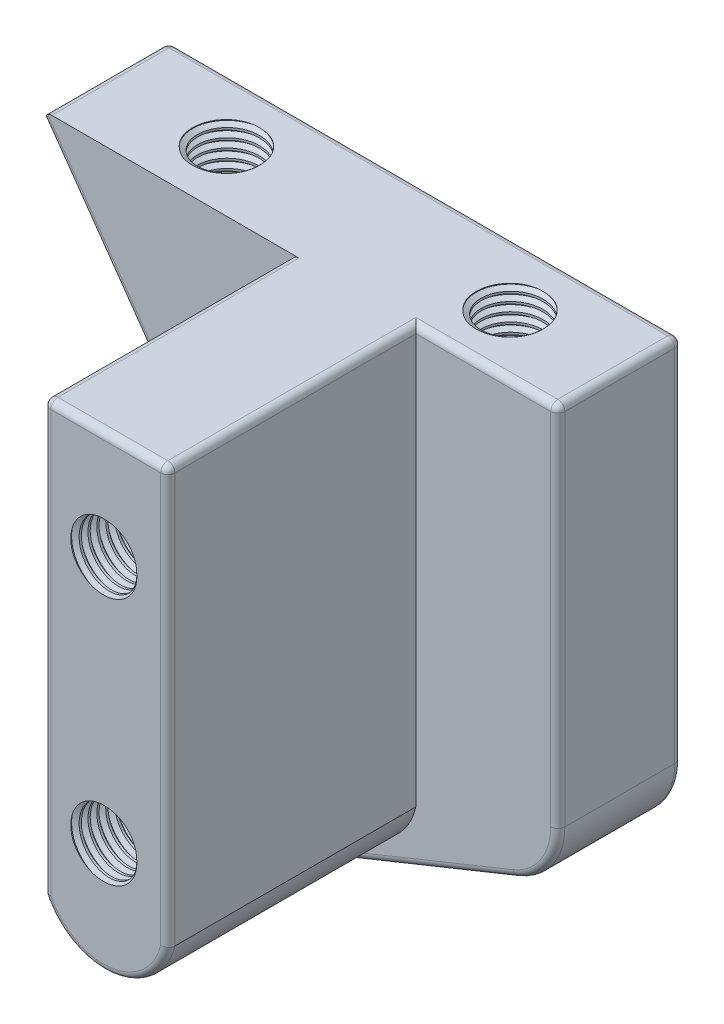
from build123d import *

# Parameters (mm, degrees)
BOSS_EXTRUDE1_DEPTH = 17.5
BOSS_EXTRUDE2_DEPTH = 70
FILLET1_R           = 2
SKETCH5_R           = 8.75
CUT_EXTRUDE1_DEPTH  = 20
THREAD2_PITCH       = 2.5
LPATTERN1_COUNT     = 2
LPATTERN1_PITCH     = 80
SKETCH14_R          = 8.75
CUT_EXTRUDE2_DEPTH  = 20
THREAD3_PITCH       = 2.5
LPATTERN4_COUNT     = 2
LPATTERN4_PITCH     = 70


with BuildPart() as part:
    # Sketch3 → Boss-Extrude1 (new, symmetric)
    with BuildSketch(Plane.XY):
        with BuildLine():
            Line((7.435410701, 82.5), (39.812976188, 36.481871211))
            ThreePointArc((39.812976188, 36.481871211), (51.493625225, 16.260583053), (53.54415303, -7.001690964))
            Line((53.54415303, -7.001690964), (45.131528365, -71.335701811))
            ThreePointArc((45.131528365, -71.335701811), (46.65027305, -75.018172101), (50.596188297, -75.563081004))
            Line((50.596188297, -75.563081004), (142.117525275, -38.586060642))
            ThreePointArc((142.117525275, -38.586060642), (150.751713879, -31.594232571), (154, -20.969567405))
            Line((154, -20.969567405), (154, 82.5))
            Line((154, 82.5), (7.435410701, 82.5))
        make_face()
    extrude(amount=BOSS_EXTRUDE1_DEPTH, both=True)

    # Sketch4 → Boss-Extrude2 (add)
    with BuildSketch(Plane.XY.offset(17.5)):
        with BuildLine():
            Line((79, 82.5), (79, -38.745011857))
            ThreePointArc((79, -38.745011857), (97.820651906, -49.432851687), (114, -35.056636828))
            Line((114, -35.056636828), (114, 82.5))
            Line((114, 82.5), (79, 82.5))
        make_face()
    extrude(amount=BOSS_EXTRUDE2_DEPTH)

    # Fillet1
    # the kernel refuses this fillet: 2 mm, written as the material it takes off along each edge
    with BuildSketch(Plane(origin=(11.28800378, 80.5, -15.5), x_dir=(0, 1, 0), z_dir=(0, 0, -1))) as fillet1_piece_1_section:
        Polygon((0, 0), (FILLET1_R, 0), (FILLET1_R, -FILLET1_R * 1.92629653958), (-FILLET1_R * 0.575427290467, -FILLET1_R * 0.817852941173), align=None)
    fillet1_piece_1 = extrude(amount=FILLET1_R, mode=Mode.PRIVATE)
    fillet1_piece_1 = fillet1_piece_1 - Plane(origin=(11.28800378, 80.5, -15.5), x_dir=(0.8875323347537564, -0.4607454337989103, 0), z_dir=(0, 0, -1)) * Sphere(FILLET1_R, mode=Mode.PRIVATE)
    add(fillet1_piece_1, mode=Mode.SUBTRACT)
    with BuildSketch(Plane(origin=(152, 80.5, -15.5), x_dir=(0, 0, -1), z_dir=(1, 0, 0))) as fillet1_piece_2_section:
        Polygon((0, 0), (FILLET1_R, 0), (FILLET1_R, FILLET1_R), (0, FILLET1_R), align=None)
    fillet1_piece_2 = extrude(amount=FILLET1_R, mode=Mode.PRIVATE)
    fillet1_piece_2 = fillet1_piece_2 - Plane(origin=(152, 80.5, -15.5), x_dir=(0, -0.7071067811865475, 0.7071067811865475), z_dir=(1, 0, 0)) * Sphere(FILLET1_R, mode=Mode.PRIVATE)
    add(fillet1_piece_2, mode=Mode.SUBTRACT)
    with BuildSketch(Plane(origin=(152, 80.5, 15.5), x_dir=(0, 1, 0), z_dir=(1, 0, 0))) as fillet1_piece_3_section:
        Polygon((0, 0), (FILLET1_R, 0), (FILLET1_R, FILLET1_R), (0, FILLET1_R), align=None)
    fillet1_piece_3 = extrude(amount=FILLET1_R, mode=Mode.PRIVATE)
    fillet1_piece_3 = fillet1_piece_3 - Plane(origin=(152, 80.5, 15.5), x_dir=(0, -0.7071067811865475, -0.7071067811865475), z_dir=(1, 0, 0)) * Sphere(FILLET1_R, mode=Mode.PRIVATE)
    add(fillet1_piece_3, mode=Mode.SUBTRACT)
    with BuildSketch(Plane(origin=(81, 80.5, 85.5), x_dir=(0, 1, 0), z_dir=(-1, 0, 0))) as fillet1_piece_4_section:
        Polygon((0, 0), (FILLET1_R, 0), (FILLET1_R, -FILLET1_R), (0, -FILLET1_R), align=None)
    fillet1_piece_4 = extrude(amount=FILLET1_R, mode=Mode.PRIVATE)
    fillet1_piece_4 = fillet1_piece_4 - Plane(origin=(81, 80.5, 85.5), x_dir=(0, -0.7071067811865475, -0.7071067811865475), z_dir=(-1, 0, 0)) * Sphere(FILLET1_R, mode=Mode.PRIVATE)
    add(fillet1_piece_4, mode=Mode.SUBTRACT)
    with BuildSketch(Plane(origin=(112, 80.5, 85.5), x_dir=(1, 0, 0), z_dir=(0, 1, 0))) as fillet1_piece_5_section:
        Polygon((0, 0), (FILLET1_R, 0), (FILLET1_R, -FILLET1_R), (0, -FILLET1_R), align=None)
    fillet1_piece_5 = extrude(amount=FILLET1_R, mode=Mode.PRIVATE)
    fillet1_piece_5 = fillet1_piece_5 - Plane(origin=(112, 80.5, 85.5), x_dir=(-0.7071067811865475, 0, -0.7071067811865475), z_dir=(0, 1, 0)) * Sphere(FILLET1_R, mode=Mode.PRIVATE)
    add(fillet1_piece_5, mode=Mode.SUBTRACT)
    with BuildSketch(Plane(origin=(9.652297898, 79.349145419, -17.5), x_dir=(0.8178529411733585, 0.5754272904669077, 0), z_dir=(0.5754272904669078, -0.8178529411733586, 0))) as fillet1_piece_6:
        with BuildLine():
            CenterArc((FILLET1_R, FILLET1_R), FILLET1_R, 180, 90)
            Line((0, FILLET1_R), (0, 0))
            Line((0, 0), (FILLET1_R, 0))
        make_face()
    extrude(amount=57.414403678, mode=Mode.SUBTRACT)
    with BuildSketch(Plane(origin=(0, 0, -17.5), x_dir=(0.6716453222878067, 0.7408728372999702, 0), z_dir=(-0.7408728372999702, 0.6716453222878067, 0))) as fillet1_piece_7:
        with BuildLine():
            CenterArc((54 + FILLET1_R, -FILLET1_R), FILLET1_R, 90, 90)
            Line((54, -FILLET1_R), (54, 0))
            Line((54, 0), (54 + FILLET1_R, 0))
        make_face()
    revolve(axis=Axis((0, 0, -17.5), (0, 0, -1)), revolution_arc=55.255821083, mode=Mode.SUBTRACT)
    with BuildSketch(Plane(origin=(53.54415303, -7.001690964, -17.5), x_dir=(0.9915583894358738, -0.12966094377003473, 0), z_dir=(-0.12966094377003473, -0.9915583894358738, 0))) as fillet1_piece_8:
        with BuildLine():
            CenterArc((FILLET1_R, FILLET1_R), FILLET1_R, 180, 90)
            Line((0, FILLET1_R), (0, 0))
            Line((0, 0), (FILLET1_R, 0))
        make_face()
    extrude(amount=64.881717035, mode=Mode.SUBTRACT)
    with BuildSketch(Plane(origin=(49.097761923, -71.854345586, -17.5), x_dir=(-0.9915583894358868, 0.1296609437699356, 0), z_dir=(0.1296609437699356, 0.9915583894358868, 0))) as fillet1_piece_9:
        with BuildLine():
            CenterArc((4 - FILLET1_R, FILLET1_R), FILLET1_R, 270, 90)
            Line((4, FILLET1_R), (4, 0))
            Line((4, 0), (4 - FILLET1_R, 0))
        make_face()
    revolve(axis=Axis((49.097761923, -71.854345586, -17.5), (0, 0, 1)), revolution_arc=119.45, mode=Mode.SUBTRACT)
    with BuildSketch(Plane(origin=(50.596188297, -75.563081004, -17.5), x_dir=(-0.37460659341590574, 0.9271838545667901, 0), z_dir=(0.92718385456679, 0.37460659341590574, 0))) as fillet1_piece_10:
        with BuildLine():
            CenterArc((FILLET1_R, FILLET1_R), FILLET1_R, 180, 90)
            Line((0, FILLET1_R), (0, 0))
            Line((0, 0), (FILLET1_R, 0))
        make_face()
    extrude(amount=98.708941627, mode=Mode.SUBTRACT)
    with BuildSketch(Plane(origin=(135, -20.969567405, -17.5), x_dir=(0.37460659341594127, -0.9271838545667757, 0), z_dir=(-0.9271838545667757, -0.37460659341594127, 0))) as fillet1_piece_11:
        with BuildLine():
            CenterArc((19 - FILLET1_R, FILLET1_R), FILLET1_R, 270, 90)
            Line((19, FILLET1_R), (19, 0))
            Line((19, 0), (19 - FILLET1_R, 0))
        make_face()
    revolve(axis=Axis((135, -20.969567405, -17.5), (0, 0, 1)), revolution_arc=68, mode=Mode.SUBTRACT)
    with BuildSketch(Plane(origin=(4.558274249, 86.589264706, 17.5), x_dir=(0.8178529411733586, 0.5754272904669078, 0), z_dir=(0.5754272904669078, -0.8178529411733586, 0))) as fillet1_piece_12:
        with BuildLine():
            CenterArc((FILLET1_R, -FILLET1_R), FILLET1_R, 90, 90)
            Line((0, -FILLET1_R), (0, 0))
            Line((0, 0), (FILLET1_R, 0))
        make_face()
    extrude(amount=66.266996757, mode=Mode.SUBTRACT)
    with BuildSketch(Plane(origin=(0, 0, 17.5), x_dir=(0.6716453222878067, 0.7408728372999702, 0), z_dir=(-0.7408728372999702, 0.6716453222878067, 0))) as fillet1_piece_13:
        with BuildLine():
            CenterArc((54 + FILLET1_R, FILLET1_R), FILLET1_R, 180, 90)
            Line((54, FILLET1_R), (54, 0))
            Line((54, 0), (54 + FILLET1_R, 0))
        make_face()
    revolve(axis=Axis((0, 0, 17.5), (0, 0, -1)), revolution_arc=55.255821083, mode=Mode.SUBTRACT)
    with BuildSketch(Plane(origin=(53.54415303, -7.001690964, 17.5), x_dir=(0.9915583894358738, -0.12966094377003473, 0), z_dir=(-0.12966094377003473, -0.9915583894358738, 0))) as fillet1_piece_14:
        with BuildLine():
            CenterArc((FILLET1_R, -FILLET1_R), FILLET1_R, 90, 90)
            Line((0, -FILLET1_R), (0, 0))
            Line((0, 0), (FILLET1_R, 0))
        make_face()
    extrude(amount=64.881717035, mode=Mode.SUBTRACT)
    with BuildSketch(Plane(origin=(49.097761923, -71.854345586, 17.5), x_dir=(-0.9915583894358868, 0.1296609437699356, 0), z_dir=(0.1296609437699356, 0.9915583894358868, 0))) as fillet1_piece_15:
        with BuildLine():
            CenterArc((4 - FILLET1_R, -FILLET1_R), FILLET1_R, 0, 90)
            Line((4, -FILLET1_R), (4, 0))
            Line((4, 0), (4 - FILLET1_R, 0))
        make_face()
    revolve(axis=Axis((49.097761923, -71.854345586, 17.5), (0, 0, 1)), revolution_arc=119.45, mode=Mode.SUBTRACT)
    with BuildSketch(Plane(origin=(50.596188297, -75.563081004, 17.5), x_dir=(-0.37460659341590574, 0.9271838545667901, 0), z_dir=(0.92718385456679, 0.37460659341590574, 0))) as fillet1_piece_16:
        with BuildLine():
            CenterArc((FILLET1_R, -FILLET1_R), FILLET1_R, 90, 90)
            Line((0, -FILLET1_R), (0, 0))
            Line((0, 0), (FILLET1_R, 0))
        make_face()
    extrude(amount=98.708941627, mode=Mode.SUBTRACT)
    with BuildSketch(Plane(origin=(135, -20.969567405, 17.5), x_dir=(0.37460659341594127, -0.9271838545667757, 0), z_dir=(-0.9271838545667757, -0.37460659341594127, 0))) as fillet1_piece_17:
        with BuildLine():
            CenterArc((19 - FILLET1_R, -FILLET1_R), FILLET1_R, 0, 90)
            Line((19, -FILLET1_R), (19, 0))
            Line((19, 0), (19 - FILLET1_R, 0))
        make_face()
    revolve(axis=Axis((135, -20.969567405, 17.5), (0, 0, 1)), revolution_arc=68, mode=Mode.SUBTRACT)
    with BuildSketch(Plane(origin=(154, -20.969567405, -17.5), x_dir=(0, 0, 1), z_dir=(0, 1, 0))) as fillet1_piece_18:
        with BuildLine():
            CenterArc((FILLET1_R, -FILLET1_R), FILLET1_R, 90, 90)
            Line((0, -FILLET1_R), (0, 0))
            Line((0, 0), (FILLET1_R, 0))
        make_face()
    extrude(amount=101.469567405, mode=Mode.SUBTRACT)
    with BuildSketch(Plane(origin=(154, -20.969567405, 17.5), x_dir=(0, 0, -1), z_dir=(0, 1, 0))) as fillet1_piece_19:
        with BuildLine():
            CenterArc((FILLET1_R, FILLET1_R), FILLET1_R, 180, 90)
            Line((0, FILLET1_R), (0, 0))
            Line((0, 0), (FILLET1_R, 0))
        make_face()
    extrude(amount=101.469567405, mode=Mode.SUBTRACT)
    with BuildSketch(Plane(origin=(95.872693848, -30.948144599, 87.5), x_dir=(-0.9866481010853995, -0.16286658535309023, 0), z_dir=(-0.16286658535309023, 0.9866481010853995, 0))) as fillet1_piece_20:
        with BuildLine():
            CenterArc((18.587063693 - FILLET1_R, -FILLET1_R), FILLET1_R, 0, 90)
            Line((18.587063693 - FILLET1_R, 0), (18.587063693, 0))
            Line((18.587063693, 0), (18.587063693, -FILLET1_R))
        make_face()
    revolve(axis=Axis((95.872693848, -30.948144599, 87.5), (0, 0, 1)), revolution_arc=173.284852225, mode=Mode.SUBTRACT)
    with BuildSketch(Plane(origin=(79, 80.5, 87.5), x_dir=(0, 0, -1), z_dir=(0, -1, 0))) as fillet1_piece_21:
        with BuildLine():
            CenterArc((FILLET1_R, FILLET1_R), FILLET1_R, 180, 90)
            Line((0, FILLET1_R), (0, 0))
            Line((0, 0), (FILLET1_R, 0))
        make_face()
    extrude(amount=124.245011857, mode=Mode.SUBTRACT)
    with BuildSketch(Plane(origin=(114, -40.056636828, 87.5), x_dir=(0, 0, -1), z_dir=(0, 1, 0))) as fillet1_piece_22:
        with BuildLine():
            CenterArc((FILLET1_R, FILLET1_R), FILLET1_R, 180, 90)
            Line((0, FILLET1_R), (0, 0))
            Line((0, 0), (FILLET1_R, 0))
        make_face()
    extrude(amount=120.556636828, mode=Mode.SUBTRACT)
    with BuildSketch(Plane(origin=(7.435410701, 82.5, -15.5), x_dir=(1, 0, 0), z_dir=(0, 0, 1))) as fillet1_piece_23:
        with BuildLine():
            CenterArc((FILLET1_R * 1.92629653958, -FILLET1_R), FILLET1_R, 90, 125.129561101)
            Line((FILLET1_R * 1.10844359841, -FILLET1_R * 1.57542729047), (0, 0))
            Line((0, 0), (FILLET1_R * 1.92629653958, 0))
        make_face()
    extrude(amount=42.631482698, mode=Mode.SUBTRACT)
    with BuildSketch(Plane(origin=(152, 82.5, 17.5), x_dir=(0, 0, -1), z_dir=(-1, 0, 0))) as fillet1_piece_24:
        with BuildLine():
            CenterArc((FILLET1_R, FILLET1_R), FILLET1_R, 180, 90)
            Line((0, FILLET1_R), (0, 0))
            Line((0, 0), (FILLET1_R, 0))
        make_face()
    extrude(amount=38, mode=Mode.SUBTRACT)
    with BuildSketch(Plane(origin=(154, 82.5, -15.5), x_dir=(0, -1, 0), z_dir=(0, 0, 1))) as fillet1_piece_25:
        with BuildLine():
            CenterArc((FILLET1_R, -FILLET1_R), FILLET1_R, 90, 90)
            Line((0, -FILLET1_R), (0, 0))
            Line((0, 0), (FILLET1_R, 0))
        make_face()
    extrude(amount=31, mode=Mode.SUBTRACT)
    with BuildSketch(Plane(origin=(152, 82.5, -17.5), x_dir=(0, -1, 0), z_dir=(-1, 0, 0))) as fillet1_piece_26:
        with BuildLine():
            CenterArc((FILLET1_R, FILLET1_R), FILLET1_R, 180, 90)
            Line((0, FILLET1_R), (0, 0))
            Line((0, 0), (FILLET1_R, 0))
        make_face()
    extrude(amount=140.71199622, mode=Mode.SUBTRACT)
    with BuildSketch(Plane(origin=(79, 82.5, 17.5), x_dir=(1, 0, 0), z_dir=(0, 0, 1))) as fillet1_piece_27:
        with BuildLine():
            CenterArc((FILLET1_R, -FILLET1_R), FILLET1_R, 90, 90)
            Line((0, -FILLET1_R), (0, 0))
            Line((0, 0), (FILLET1_R, 0))
        make_face()
    extrude(amount=68, mode=Mode.SUBTRACT)
    with BuildSketch(Plane(origin=(112, 82.5, 87.5), x_dir=(0, 0, -1), z_dir=(-1, 0, 0))) as fillet1_piece_28:
        with BuildLine():
            CenterArc((FILLET1_R, FILLET1_R), FILLET1_R, 180, 90)
            Line((0, FILLET1_R), (0, 0))
            Line((0, 0), (FILLET1_R, 0))
        make_face()
    extrude(amount=31, mode=Mode.SUBTRACT)
    with BuildSketch(Plane(origin=(114, 82.5, 17.5), x_dir=(-1, 0, 0), z_dir=(0, 0, 1))) as fillet1_piece_29:
        with BuildLine():
            CenterArc((FILLET1_R, FILLET1_R), FILLET1_R, 180, 90)
            Line((0, FILLET1_R), (0, 0))
            Line((0, 0), (FILLET1_R, 0))
        make_face()
    extrude(amount=68, mode=Mode.SUBTRACT)
    with BuildSketch(Plane(origin=(114, 82.5, 12.5), x_dir=(-1, 0, 0), z_dir=(0, 0, 1))) as fillet1_piece_30a_section:
        with BuildLine():
            CenterArc((FILLET1_R, FILLET1_R), FILLET1_R, 180, 90)
            Line((0, FILLET1_R), (0, 0))
            Line((0, 0), (FILLET1_R, 0))
        make_face()
    fillet1_piece_30a = extrude(amount=73, mode=Mode.PRIVATE)
    fillet1_piece_30a = split(fillet1_piece_30a, bisect_by=Plane(origin=(113.547209771, 82.047209771, 17.5), z_dir=(0, 0, -1)), keep=Keep.TOP, mode=Mode.PRIVATE)
    with BuildSketch(Plane(origin=(152, 82.5, 17.5), x_dir=(0, 0, -1), z_dir=(-1, 0, 0))) as fillet1_piece_30b_section:
        with BuildLine():
            CenterArc((FILLET1_R, FILLET1_R), FILLET1_R, 180, 90)
            Line((0, FILLET1_R), (0, 0))
            Line((0, 0), (FILLET1_R, 0))
        make_face()
    fillet1_piece_30b = extrude(amount=43, mode=Mode.PRIVATE)
    fillet1_piece_30b = split(fillet1_piece_30b, bisect_by=Plane(origin=(114, 82.047209771, 17.047209771), z_dir=(-1, 0, 0)), keep=Keep.TOP, mode=Mode.PRIVATE)
    fillet1_piece_30 = fillet1_piece_30a & fillet1_piece_30b
    add(fillet1_piece_30, mode=Mode.SUBTRACT)

    # Sketch5 → Cut-Extrude1 (cut)
    with BuildSketch(Plane(origin=(0, 82.5, 0), x_dir=(1, 0, 0), z_dir=(0, 1, 0))):
        with Locations(Location((124, 0, 0), (0, 0, 270))):
            Circle(SKETCH5_R)
    cut_extrude1 = extrude(amount=-CUT_EXTRUDE1_DEPTH, mode=Mode.SUBTRACT)

    # Thread2: the profile of Thread Profile2 profile screwed along a right-hand helix of 8 turns, 10 arcs to a turn; built about Z, then put on its axis
    thread2_z = Axis((0, 0, 0), (0, 0, 1))
    thread2_corners = [(8.7497, 0, -0.000173205), (10.103164688, 0, 0.781249997), (10.103164688, 0, 1.093749997), (8.7497, 0, 1.875173198)]
    with BuildLine(mode=Mode.PRIVATE) as thread2_profile:
        Line(thread2_corners[0], thread2_corners[1])
        Line(thread2_corners[1], thread2_corners[2])
        Line(thread2_corners[2], thread2_corners[3])
        Line(thread2_corners[3], thread2_corners[0])
    thread2_cap = Face(thread2_profile.wire())
    thread2_turn_angles = [0, 18, 36, 54, 72, 90, 108, 126, 144, 162, 180, 198, 216, 234, 252, 270, 288, 306, 324, 342, 360]
    thread2_turn_weights = [1, 0.9510565162951535, 1, 0.9510565162951535, 1, 0.9510565162951535, 1, 0.9510565162951535, 1, 0.9510565162951535, 1, 0.9510565162951535, 1, 0.9510565162951535, 1, 0.9510565162951535, 1, 0.9510565162951535, 1, 0.9510565162951535, 1]
    thread2_turn_rails = [Edge.make_bspline([Vector(p[0], p[1], 0).rotate(thread2_z, thread2_turn_angles[k]) / thread2_turn_weights[k] + Vector(0, 0, p[2] + THREAD2_PITCH * thread2_turn_angles[k] / 360) for k in range(21)], [0, 0, 0, 1, 1, 2, 2, 3, 3, 4, 4, 5, 5, 6, 6, 7, 7, 8, 8, 9, 9, 10, 10, 10], 2, thread2_turn_weights) for p in thread2_corners]
    thread2_turn_sides = [Face.make_surface_from_curves(thread2_turn_rails[p[0]], thread2_turn_rails[p[1]]) for p in [(0, 1), (1, 2), (2, 3), (3, 0)]]
    thread2 = Plane(origin=(124, 62.5, 0), x_dir=(1, 0, 0), z_dir=(0, 1, 0)) * Solid(Shell([*[p.moved(Location((0, 0, THREAD2_PITCH * i))) for i in range(8) for p in thread2_turn_sides], thread2_cap, thread2_cap.rotate(thread2_z, 2880).moved(Location((0, 0, THREAD2_PITCH * 2880 / 360)))]))
    add(thread2, mode=Mode.SUBTRACT)

    # LPattern1: Cut-Extrude1, Thread2 ×2
    with Locations(*[(-i * LPATTERN1_PITCH, 0, 0) for i in range(1, LPATTERN1_COUNT)]):
        add(cut_extrude1, mode=Mode.SUBTRACT)
        add(thread2, mode=Mode.SUBTRACT)

    # Sketch14 → Cut-Extrude2 (cut)
    with BuildSketch(Plane.XY.offset(87.5)):
        with Locations((96.5, 52.5)):
            Circle(SKETCH14_R)
    cut_extrude2 = extrude(amount=-CUT_EXTRUDE2_DEPTH, mode=Mode.SUBTRACT)

    # Thread3: the profile of Thread Profile3 profile screwed along a right-hand helix of 8 turns, 10 arcs to a turn; built about Z, then put on its axis
    thread3_z = Axis((0, 0, 0), (0, 0, 1))
    thread3_corners = [(8.7497, 0, -0.000173205), (10.103164687, 0, 0.781249997), (10.103164687, 0, 1.093749997), (8.7497, 0, 1.875173198)]
    with BuildLine(mode=Mode.PRIVATE) as thread3_profile:
        Line(thread3_corners[0], thread3_corners[1])
        Line(thread3_corners[1], thread3_corners[2])
        Line(thread3_corners[2], thread3_corners[3])
        Line(thread3_corners[3], thread3_corners[0])
    thread3_cap = Face(thread3_profile.wire())
    thread3_turn_angles = [0, 18, 36, 54, 72, 90, 108, 126, 144, 162, 180, 198, 216, 234, 252, 270, 288, 306, 324, 342, 360]
    thread3_turn_weights = [1, 0.9510565162951535, 1, 0.9510565162951535, 1, 0.9510565162951535, 1, 0.9510565162951535, 1, 0.9510565162951535, 1, 0.9510565162951535, 1, 0.9510565162951535, 1, 0.9510565162951535, 1, 0.9510565162951535, 1, 0.9510565162951535, 1]
    thread3_turn_rails = [Edge.make_bspline([Vector(p[0], p[1], 0).rotate(thread3_z, thread3_turn_angles[k]) / thread3_turn_weights[k] + Vector(0, 0, p[2] + THREAD3_PITCH * thread3_turn_angles[k] / 360) for k in range(21)], [0, 0, 0, 1, 1, 2, 2, 3, 3, 4, 4, 5, 5, 6, 6, 7, 7, 8, 8, 9, 9, 10, 10, 10], 2, thread3_turn_weights) for p in thread3_corners]
    thread3_turn_sides = [Face.make_surface_from_curves(thread3_turn_rails[p[0]], thread3_turn_rails[p[1]]) for p in [(0, 1), (1, 2), (2, 3), (3, 0)]]
    thread3 = Plane(origin=(96.5, 52.5, 67.5), x_dir=(1, 0, 0), z_dir=(0, 0, 1)) * Solid(Shell([*[p.moved(Location((0, 0, THREAD3_PITCH * i))) for i in range(8) for p in thread3_turn_sides], thread3_cap, thread3_cap.rotate(thread3_z, 2880).moved(Location((0, 0, THREAD3_PITCH * 2880 / 360)))]))
    add(thread3, mode=Mode.SUBTRACT)

    # LPattern4: Cut-Extrude2, Thread3 ×2
    with Locations(*[(0, -i * LPATTERN4_PITCH, 0) for i in range(1, LPATTERN4_COUNT)]):
        add(cut_extrude2, mode=Mode.SUBTRACT)
        add(thread3, mode=Mode.SUBTRACT)


solid = part.part
